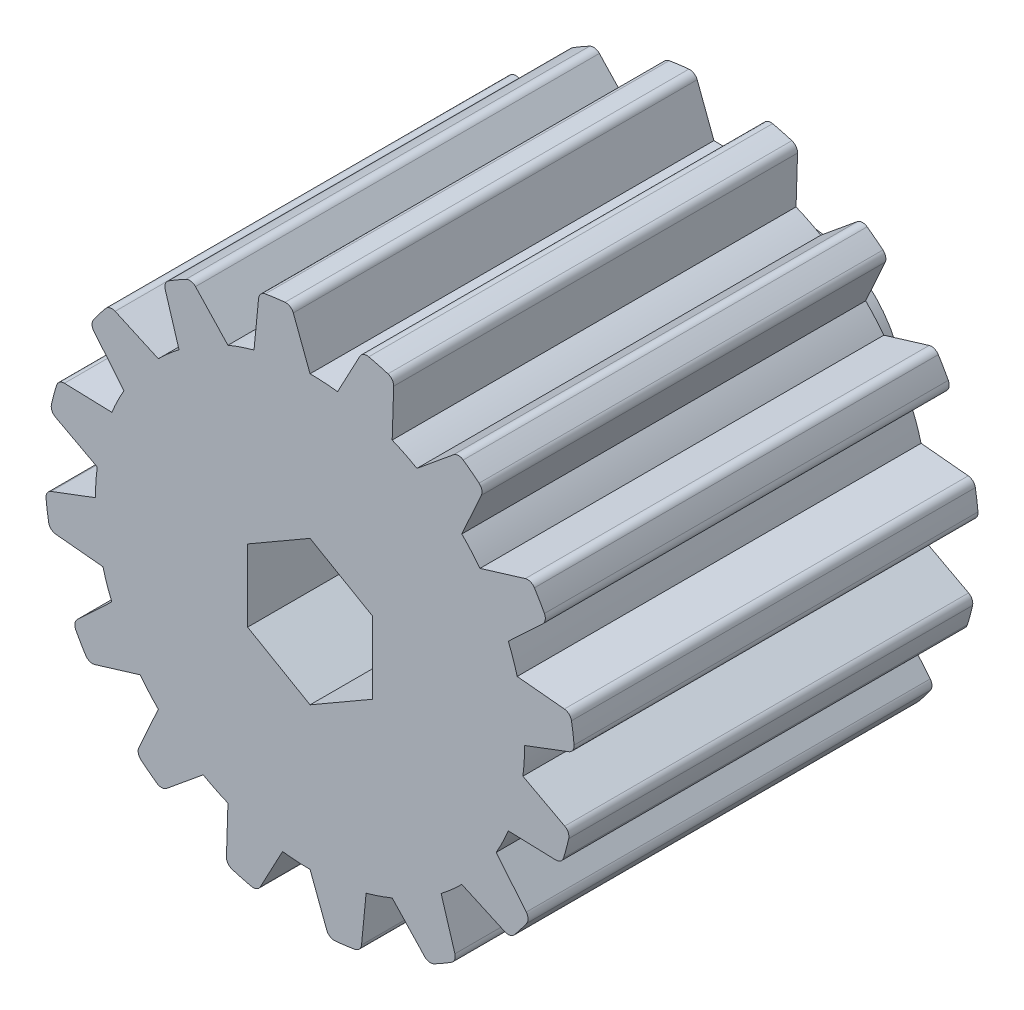
from build123d import *

# Parameters (mm, degrees)
SALIENTE_EXTRUIR1_DEPTH    = 15
CROQUIS5_R                 = 4.5
SALIENTE_EXTRUIR2_DEPTH    = 6
ESCALA1_SCALE              = 1.5
CORTAR_EXTRUIR3_DEPTH      = 38.7502155
CORTAR_EXTRUIR3_DEPTH_BACK = 5.8
CROQUIS7_R                 = 10
CROQUIS8_R                 = 5.5
SALIENTE_EXTRUIR3_DEPTH    = 1.87
CORTAR_EXTRUIR4_DEPTH      = 35.538871873
CORTAR_EXTRUIR4_DEPTH_BACK = 35.538871873


with BuildPart() as part:
    # Croquis2 → Saliente-Extruir1 (new body)
    with BuildSketch(Plane.XY):
        with BuildLine():
            Line((-2.081696937, 7.693567449), (-1.911179214, 9.445287663))
            ThreePointArc((-1.911179214, 9.445287663), (-1.831468139, 9.618345927), (-1.663611198, 9.708496165))
            ThreePointArc((-1.663611198, 9.708496165), (-1.297642615, 9.764149919), (-0.929841298, 9.806013214))
            ThreePointArc((-0.929841298, 9.806013214), (-0.744265019, 9.762833784), (-0.622120698, 9.616601835))
            Line((-0.622120698, 9.616601835), (0, 7.97022222))
            ThreePointArc((0, 7.97022222), (0.511536449, 7.953789832), (1.020963606, 7.904560428))
            Line((1.020963606, 7.904560428), (1.848855744, 9.457684572))
            ThreePointArc((1.848855744, 9.457684572), (1.988725705, 9.587065453), (2.1783043, 9.606117341))
            ThreePointArc((2.1783043, 9.606117341), (2.537712953, 9.517484592), (2.893537451, 9.415409764))
            ThreePointArc((2.893537451, 9.415409764), (3.048463524, 9.304500205), (3.105349619, 9.122656892))
            Line((3.105349619, 9.122656892), (3.050071996, 7.363525179))
            ThreePointArc((3.050071996, 7.363525179), (3.516381649, 7.152587108), (3.968191694, 6.912155736))
            Line((3.968191694, 6.912155736), (5.327419174, 8.030234739))
            ThreePointArc((5.327419174, 8.030234739), (5.506154088, 8.09624117), (5.688592714, 8.041294232))
            ThreePointArc((5.688592714, 8.041294232), (5.986724728, 7.821868513), (6.276401353, 7.591395527))
            ThreePointArc((6.276401353, 7.591395527), (6.37709113, 7.429640815), (6.360058606, 7.239870134))
            Line((6.360058606, 7.239870134), (5.635798179, 5.635798179))
            ThreePointArc((5.635798179, 5.635798179), (5.985889619, 5.262467835), (6.311298569, 4.867437992))
            Line((6.311298569, 4.867437992), (7.994931329, 5.380254461))
            ThreePointArc((7.994931329, 5.380254461), (8.185320425, 5.372837562), (8.332844455, 5.252256971))
            ThreePointArc((8.332844455, 5.252256971), (8.524311933, 4.935443857), (8.703740045, 4.611660138))
            ThreePointArc((8.703740045, 4.611660138), (8.73486442, 4.42368596), (8.646506324, 4.254878777))
            Line((8.646506324, 4.254878777), (7.363525179, 3.050071996))
            ThreePointArc((7.363525179, 3.050071996), (7.544100156, 2.571185538), (7.693567449, 2.081696937))
            Line((7.693567449, 2.081696937), (9.445287663, 1.911179214))
            ThreePointArc((9.445287663, 1.911179214), (9.618345927, 1.831468139), (9.708496165, 1.663611198))
            ThreePointArc((9.708496165, 1.663611198), (9.764149919, 1.297642615), (9.806013214, 0.929841298))
            ThreePointArc((9.806013214, 0.929841298), (9.762833784, 0.744265019), (9.616601835, 0.622120698))
            Line((9.616601835, 0.622120698), (7.97022222, 0))
            ThreePointArc((7.97022222, 0), (7.953789832, -0.511536449), (7.904560428, -1.020963606))
            Line((7.904560428, -1.020963606), (9.457684572, -1.848855744))
            ThreePointArc((9.457684572, -1.848855744), (9.587065453, -1.988725705), (9.606117341, -2.1783043))
            ThreePointArc((9.606117341, -2.1783043), (9.517484592, -2.537712953), (9.415409764, -2.893537451))
            ThreePointArc((9.415409764, -2.893537451), (9.304500205, -3.048463524), (9.122656892, -3.105349619))
            Line((9.122656892, -3.105349619), (7.363525179, -3.050071996))
            ThreePointArc((7.363525179, -3.050071996), (7.152587108, -3.516381649), (6.912155736, -3.968191694))
            Line((6.912155736, -3.968191694), (8.030234739, -5.327419174))
            ThreePointArc((8.030234739, -5.327419174), (8.09624117, -5.506154088), (8.041294232, -5.688592714))
            ThreePointArc((8.041294232, -5.688592714), (7.821868513, -5.986724728), (7.591395527, -6.276401353))
            ThreePointArc((7.591395527, -6.276401353), (7.429640815, -6.37709113), (7.239870134, -6.360058606))
            Line((7.239870134, -6.360058606), (5.635798179, -5.635798179))
            ThreePointArc((5.635798179, -5.635798179), (5.262467835, -5.985889619), (4.867437992, -6.311298569))
            Line((4.867437992, -6.311298569), (5.380254461, -7.994931329))
            ThreePointArc((5.380254461, -7.994931329), (5.372837562, -8.185320425), (5.252256971, -8.332844455))
            ThreePointArc((5.252256971, -8.332844455), (4.935443857, -8.524311933), (4.611660138, -8.703740045))
            ThreePointArc((4.611660138, -8.703740045), (4.42368596, -8.73486442), (4.254878777, -8.646506324))
            Line((4.254878777, -8.646506324), (3.050071996, -7.363525179))
            ThreePointArc((3.050071996, -7.363525179), (2.571185538, -7.544100156), (2.081696937, -7.693567449))
            Line((2.081696937, -7.693567449), (1.911179214, -9.445287663))
            ThreePointArc((1.911179214, -9.445287663), (1.831468139, -9.618345927), (1.663611198, -9.708496165))
            ThreePointArc((1.663611198, -9.708496165), (1.297642615, -9.764149919), (0.929841298, -9.806013214))
            ThreePointArc((0.929841298, -9.806013214), (0.744265019, -9.762833784), (0.622120698, -9.616601835))
            Line((0.622120698, -9.616601835), (0, -7.97022222))
            ThreePointArc((0, -7.97022222), (-0.511536449, -7.953789832), (-1.020963606, -7.904560428))
            Line((-1.020963606, -7.904560428), (-1.848855744, -9.457684572))
            ThreePointArc((-1.848855744, -9.457684572), (-1.988725705, -9.587065453), (-2.1783043, -9.606117341))
            ThreePointArc((-2.1783043, -9.606117341), (-2.537712953, -9.517484592), (-2.893537451, -9.415409764))
            ThreePointArc((-2.893537451, -9.415409764), (-3.048463524, -9.304500205), (-3.105349619, -9.122656892))
            Line((-3.105349619, -9.122656892), (-3.050071996, -7.363525179))
            ThreePointArc((-3.050071996, -7.363525179), (-3.516381649, -7.152587108), (-3.968191694, -6.912155736))
            Line((-3.968191694, -6.912155736), (-5.327419174, -8.030234739))
            ThreePointArc((-5.327419174, -8.030234739), (-5.506154088, -8.09624117), (-5.688592714, -8.041294232))
            ThreePointArc((-5.688592714, -8.041294232), (-5.986724728, -7.821868513), (-6.276401353, -7.591395527))
            ThreePointArc((-6.276401353, -7.591395527), (-6.37709113, -7.429640815), (-6.360058606, -7.239870134))
            Line((-6.360058606, -7.239870134), (-5.635798179, -5.635798179))
            ThreePointArc((-5.635798179, -5.635798179), (-5.985889619, -5.262467835), (-6.311298569, -4.867437992))
            Line((-6.311298569, -4.867437992), (-7.994931329, -5.380254461))
            ThreePointArc((-7.994931329, -5.380254461), (-8.185320425, -5.372837562), (-8.332844455, -5.252256971))
            ThreePointArc((-8.332844455, -5.252256971), (-8.524311933, -4.935443857), (-8.703740045, -4.611660138))
            ThreePointArc((-8.703740045, -4.611660138), (-8.73486442, -4.42368596), (-8.646506324, -4.254878777))
            Line((-8.646506324, -4.254878777), (-7.363525179, -3.050071996))
            ThreePointArc((-7.363525179, -3.050071996), (-7.544100156, -2.571185538), (-7.693567449, -2.081696937))
            Line((-7.693567449, -2.081696937), (-9.445287663, -1.911179214))
            ThreePointArc((-9.445287663, -1.911179214), (-9.618345927, -1.831468139), (-9.708496165, -1.663611198))
            ThreePointArc((-9.708496165, -1.663611198), (-9.764149919, -1.297642615), (-9.806013214, -0.929841298))
            ThreePointArc((-9.806013214, -0.929841298), (-9.762833784, -0.744265019), (-9.616601835, -0.622120698))
            Line((-9.616601835, -0.622120698), (-7.97022222, 0))
            ThreePointArc((-7.97022222, 0), (-7.953789832, 0.511536449), (-7.904560428, 1.020963606))
            Line((-7.904560428, 1.020963606), (-9.457684572, 1.848855744))
            ThreePointArc((-9.457684572, 1.848855744), (-9.587065453, 1.988725705), (-9.606117341, 2.1783043))
            ThreePointArc((-9.606117341, 2.1783043), (-9.517484592, 2.537712953), (-9.415409764, 2.893537451))
            ThreePointArc((-9.415409764, 2.893537451), (-9.304500205, 3.048463524), (-9.122656892, 3.105349619))
            Line((-9.122656892, 3.105349619), (-7.363525179, 3.050071996))
            ThreePointArc((-7.363525179, 3.050071996), (-7.152587108, 3.516381649), (-6.912155736, 3.968191694))
            Line((-6.912155736, 3.968191694), (-8.030234739, 5.327419174))
            ThreePointArc((-8.030234739, 5.327419174), (-8.09624117, 5.506154088), (-8.041294232, 5.688592714))
            ThreePointArc((-8.041294232, 5.688592714), (-7.821868513, 5.986724728), (-7.591395527, 6.276401353))
            ThreePointArc((-7.591395527, 6.276401353), (-7.429640815, 6.37709113), (-7.239870134, 6.360058606))
            Line((-7.239870134, 6.360058606), (-5.635798179, 5.635798179))
            ThreePointArc((-5.635798179, 5.635798179), (-5.262467835, 5.985889619), (-4.867437992, 6.311298569))
            Line((-4.867437992, 6.311298569), (-5.380254461, 7.994931329))
            ThreePointArc((-5.380254461, 7.994931329), (-5.372837562, 8.185320425), (-5.252256971, 8.332844455))
            ThreePointArc((-5.252256971, 8.332844455), (-4.935443857, 8.524311933), (-4.611660138, 8.703740045))
            ThreePointArc((-4.611660138, 8.703740045), (-4.42368596, 8.73486442), (-4.254878777, 8.646506324))
            Line((-4.254878777, 8.646506324), (-3.050071996, 7.363525179))
            ThreePointArc((-3.050071996, 7.363525179), (-2.571185538, 7.544100156), (-2.081696937, 7.693567449))
        make_face()
    extrude(amount=SALIENTE_EXTRUIR1_DEPTH)

    # Croquis5 → Saliente-Extruir2 (add)
    with BuildSketch(Plane(origin=(0, 0, 0), x_dir=(-1, 0, 0), z_dir=(0, 0, -1))):
        Circle(CROQUIS5_R)
    extrude(amount=SALIENTE_EXTRUIR2_DEPTH)


with BuildPart() as part_1:
    # Escala1: scaled about (0, 0, 0)
    add(part.part.scale(ESCALA1_SCALE))

    # Croquis7 → Cortar-Extruir3 (cut, two sides: drawn at the far end of the back side and taken through both)
    with BuildSketch(Plane(origin=(0, 0, -9), x_dir=(-1, 0, 0), z_dir=(0, 0, -1)).offset(-CORTAR_EXTRUIR3_DEPTH_BACK)):
        Circle(CROQUIS7_R)
    extrude(amount=CORTAR_EXTRUIR3_DEPTH + CORTAR_EXTRUIR3_DEPTH_BACK, mode=Mode.SUBTRACT)

    # Croquis8 → Saliente-Extruir3 (add)
    with BuildSketch(Plane(origin=(0, 0, -3.2), x_dir=(-1, 0, 0), z_dir=(0, 0, -1))):
        Circle(CROQUIS8_R)
    extrude(amount=SALIENTE_EXTRUIR3_DEPTH)

    # Croquis10 → Cortar-Extruir4 (cut, two sides: drawn at the far end of the back side and taken through both)
    with BuildSketch(Plane.XY.offset(22.5).offset(-CORTAR_EXTRUIR4_DEPTH_BACK)):
        Polygon((0, 4.015470054), (-3.477499075, 2.007735027), (-3.477499075, -2.007735027), (0, -4.015470054), (3.477499075, -2.007735027), (3.477499075, 2.007735027), align=None)
    extrude(amount=CORTAR_EXTRUIR4_DEPTH + CORTAR_EXTRUIR4_DEPTH_BACK, mode=Mode.SUBTRACT)


solid = part_1.part
